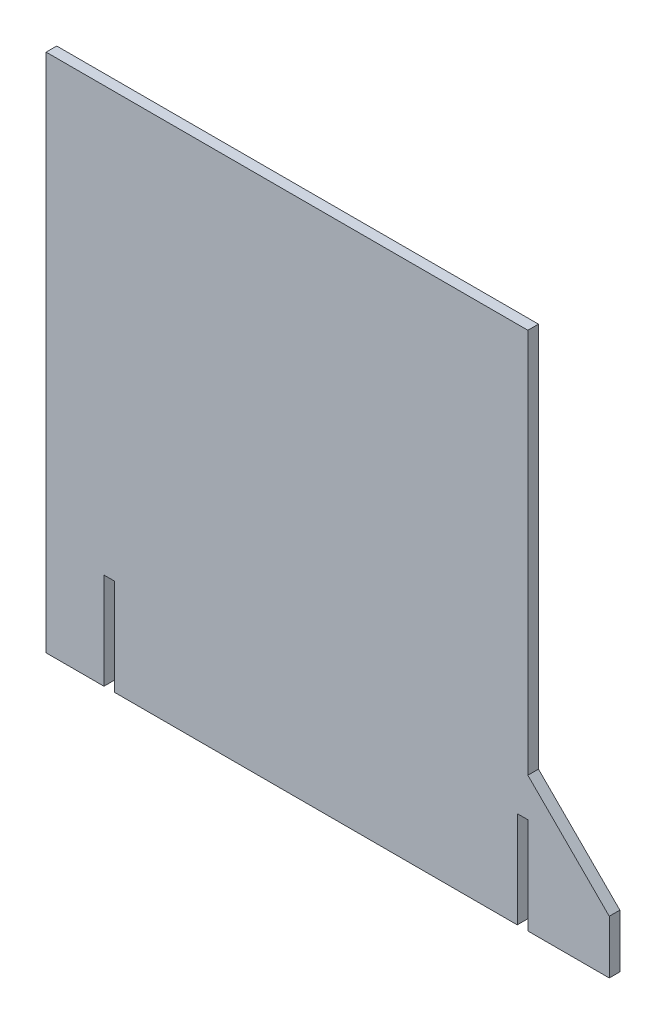
from build123d import *

# Parameters (mm, degrees)
EXTRUDE_1_DEPTH     = 5.5
SKETCH_4_W          = 5.5
SKETCH_4_H          = 50
CUT_EXTRUDE_2_DEPTH = 10


with BuildPart() as part:
    # 草圖1 → 填料-伸長1 (new body)
    with BuildSketch(Plane.XY):
        Polygon((250, 70), (292.246300115, 27.753699885), (292.246300115, 0), (142.246300115, 0), (0, 0), (0, 270), (250, 270), align=None)
    extrude(amount=EXTRUDE_1_DEPTH)

    # 草圖4 → 除料-伸長2 (cut)
    with BuildSketch(Plane.XY.offset(5.5)):
        with Locations((32.75, 25)):
            Rectangle(SKETCH_4_W, SKETCH_4_H)
        with Locations((247.25, 25)):
            Rectangle(SKETCH_4_W, SKETCH_4_H)
    extrude(amount=-CUT_EXTRUDE_2_DEPTH, mode=Mode.SUBTRACT)


solid = part.part
